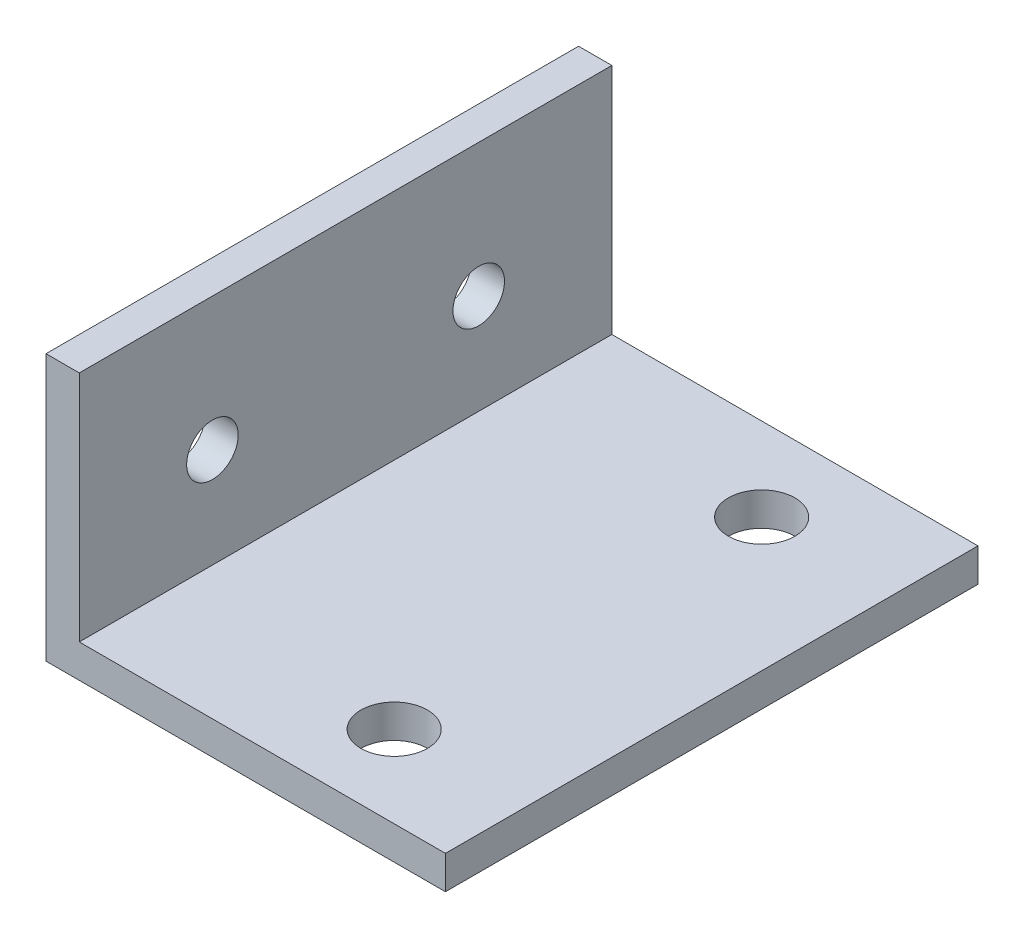
from build123d import *

# Parameters (mm, degrees)
BOSS_EXTRUDE1_DEPTH              = 25.4
F_1_4_0_25_DIAMETER_HOLE1_D      = 6.35
F_1_4_0_25_DIAMETER_HOLE1_DEPTH  = 17.526
F_1_4_0_25_DIAMETER_HOLE1_TIP    = 1.907732465
F_10_0_1935_DIAMETER_HOLE1_D     = 4.9149
F_10_0_1935_DIAMETER_HOLE1_DEPTH = 17.526
F_10_0_1935_DIAMETER_HOLE1_TIP   = 1.476584928


with BuildPart() as part:
    # Sketch1 → Boss-Extrude1 (new, symmetric)
    with BuildSketch(Plane.XY):
        Polygon((-8.126488095, 19.768154762), (-8.126488095, -5.631845238), (29.973511905, -5.631845238), (29.973511905, -2.456845238), (-4.951488095, -2.456845238), (-4.951488095, 19.768154762), align=None)
    extrude(amount=BOSS_EXTRUDE1_DEPTH, both=True)

    # 1/4 (0.25) Diameter Hole1
    with Locations(Plane(origin=(0, -2.456845238, 0), x_dir=(1, 0, 0), z_dir=(0, 1, 0))):
        with Locations((17.273511905, 17.4625), (17.273511905, -17.5895)):
            Hole(F_1_4_0_25_DIAMETER_HOLE1_D / 2, depth=F_1_4_0_25_DIAMETER_HOLE1_DEPTH)
            with Locations((0, 0, -(F_1_4_0_25_DIAMETER_HOLE1_DEPTH + F_1_4_0_25_DIAMETER_HOLE1_TIP / 2))):  # 118° drill point
                Cone(0, F_1_4_0_25_DIAMETER_HOLE1_D / 2, F_1_4_0_25_DIAMETER_HOLE1_TIP, mode=Mode.SUBTRACT)

    # #10 (0.1935) Diameter Hole1
    with Locations(Plane(origin=(-4.951488095, 0, 0), x_dir=(0, 0, -1), z_dir=(1, 0, 0))):
        with Locations((12.7, 7.068154762), (-12.7, 7.068154762)):
            Hole(F_10_0_1935_DIAMETER_HOLE1_D / 2, depth=F_10_0_1935_DIAMETER_HOLE1_DEPTH)
            with Locations((0, 0, -(F_10_0_1935_DIAMETER_HOLE1_DEPTH + F_10_0_1935_DIAMETER_HOLE1_TIP / 2))):  # 118° drill point
                Cone(0, F_10_0_1935_DIAMETER_HOLE1_D / 2, F_10_0_1935_DIAMETER_HOLE1_TIP, mode=Mode.SUBTRACT)


solid = part.part
